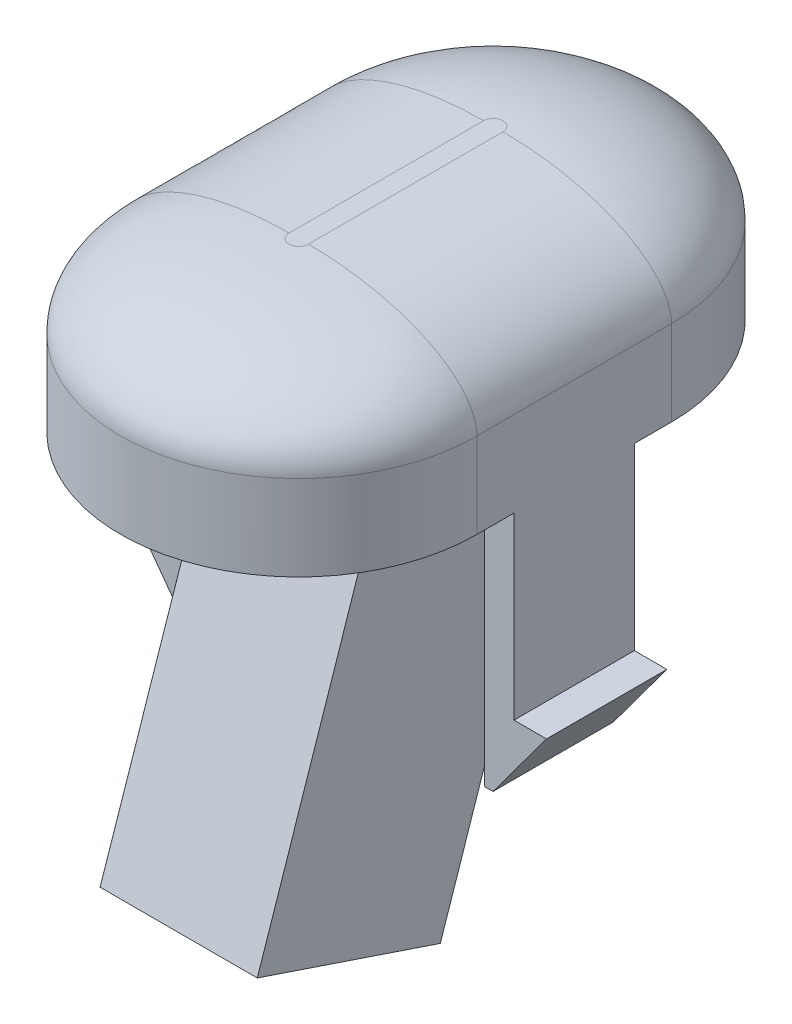
from build123d import *

# Parameters (mm, degrees)
SKETCH1_W           = 14.8
SKETCH1_H           = 8.08
BOSS_EXTRUDE1_DEPTH = 6.94
FILLET1_SIZE        = 7
FILLET1_SIZE_2      = 3.4
SKETCH2_W           = 2.5
SKETCH2_H           = 5
BOSS_EXTRUDE2_DEPTH = 7.45
SKETCH3_W           = 4.44
SKETCH3_H           = 5
BOSS_EXTRUDE3_DEPTH = 3
CUT_EXTRUDE1_REACH  = 26.161
CUT_EXTRUDE2_REACH  = 26.161
CUT_EXTRUDE3_REACH  = 25.756
SKETCH6_W           = 1.27
SKETCH6_H           = 10.45
SKETCH7_W           = 6.5278
SKETCH7_H           = 5
SKETCH7_H_2         = 1.3
BOSS_EXTRUDE4_DEPTH = 2.55634
CUT_EXTRUDE4_REACH  = 24.207
SKETCH9_W           = 6.5278
SKETCH9_H           = 8.018408457
SKETCH9_W_2         = 4.3283
SKETCH9_H_2         = 5.8777
BOSS_EXTRUDE5_DEPTH = 16.3863


with BuildPart() as part:
    # Sketch1 → Boss-Extrude1 (new body)
    with BuildSketch(Plane(origin=(0, 0, 0), x_dir=(1, 0, 0), z_dir=(0, 1, 0))):
        with BuildLine():
            Line((0, -8.08), (14.8, -8.08))
            ThreePointArc((14.8, -8.08), (7.4, -15.48), (0, -8.08))
        make_face()
        with Locations((7.4, -4.04)):
            Rectangle(SKETCH1_W, SKETCH1_H)
        with BuildLine():
            ThreePointArc((0, 0), (7.4, 7.4), (14.8, 0))
            Line((14.8, 0), (0, 0))
        make_face()
    extrude(amount=BOSS_EXTRUDE1_DEPTH)

    # Fillet1
    # an asymmetric fillet: 7, 3.4 mm, written as the material it takes off along each edge
    with BuildSketch(Plane(origin=(7.4, 6.94, 0), x_dir=(-1, 0, 0), z_dir=(0, 0, 1))) as fillet1_piece_1:
        with BuildLine():
            Bezier((7.4 - FILLET1_SIZE, 0), (7.4, 0), (7.4, FILLET1_SIZE_2), weights=[1, 0.707106781, 1])
            Line((7.4, FILLET1_SIZE_2), (7.4, 0))
            Line((7.4, 0), (7.4 - FILLET1_SIZE, 0))
        make_face()
    revolve(axis=Axis((7.4, 6.94, 0), (0, -1, 0)), revolution_arc=180, mode=Mode.SUBTRACT)
    with BuildSketch(Plane(origin=(0, 6.94, 8.08), x_dir=(0, -1, 0), z_dir=(0, 0, -1)), Plane(origin=(14.8, 6.94, 0), x_dir=(0, -1, 0), z_dir=(0, 0, 1))) as fillet1_piece_2:
        with BuildLine():
            Bezier((FILLET1_SIZE_2, 0), (0, 0), (0, -FILLET1_SIZE), weights=[1, 0.707106781, 1])
            Line((0, -FILLET1_SIZE), (0, 0))
            Line((0, 0), (FILLET1_SIZE_2, 0))
        make_face()
    extrude(amount=8.08, mode=Mode.SUBTRACT)
    with BuildSketch(Plane(origin=(7.4, 6.94, 8.08), x_dir=(1, 0, 0), z_dir=(0, 0, -1))) as fillet1_piece_3:
        with BuildLine():
            Bezier((7.4, FILLET1_SIZE_2), (7.4, 0), (7.4 - FILLET1_SIZE, 0), weights=[1, 0.707106781, 1])
            Line((7.4 - FILLET1_SIZE, 0), (7.4, 0))
            Line((7.4, 0), (7.4, FILLET1_SIZE_2))
        make_face()
    revolve(axis=Axis((7.4, 6.94, 8.08), (0, -1, 0)), revolution_arc=180, mode=Mode.SUBTRACT)

    # Sketch2 → Boss-Extrude2 (add)
    with BuildSketch(Plane.XZ):
        with Locations((1.25, 4.04)):
            Rectangle(SKETCH2_W, SKETCH2_H)
        with Locations((13.55, 4.04)):
            Rectangle(SKETCH2_W, SKETCH2_H)
    extrude(amount=BOSS_EXTRUDE2_DEPTH)

    # Sketch3 → Boss-Extrude3 (add)
    with BuildSketch(Plane(origin=(0, -7.45, 0), x_dir=(-1, 0, 0), z_dir=(0, -1, 0))):
        with Locations((-0.28, -4.04)):
            Rectangle(SKETCH3_W, SKETCH3_H)
        with Locations((-14.52, -4.04)):
            Rectangle(SKETCH3_W, SKETCH3_H)
    extrude(amount=BOSS_EXTRUDE3_DEPTH)

    # Sketch4 → Cut-Extrude1 (cut, up to next)
    with BuildSketch(Plane(origin=(0, 0, 1.54), x_dir=(-1, 0, 0), z_dir=(0, 0, -1)), mode=Mode.PRIVATE) as cut_extrude1_sk1:
        Polygon((1.94, -7.45), (-0.28, -10.45), (1.94, -10.45), align=None)
    cut_extrude1_tool1 = extrude(cut_extrude1_sk1.sketch, amount=-CUT_EXTRUDE1_REACH, mode=Mode.PRIVATE) & part.part
    # Sketch4 → Cut-Extrude1 (cut, up to next)
    with BuildSketch(Plane(origin=(0, 0, 1.54), x_dir=(-1, 0, 0), z_dir=(0, 0, -1)), mode=Mode.PRIVATE) as cut_extrude1_sk2:
        Polygon((-16.74, -7.45), (-16.74, -10.45), (-14.52, -10.45), align=None)
    cut_extrude1_tool2 = extrude(cut_extrude1_sk2.sketch, amount=-CUT_EXTRUDE1_REACH, mode=Mode.PRIVATE) & part.part
    add(cut_extrude1_tool1.solids().sort_by_distance((-1.2, -9.45, 1.54))[0], mode=Mode.SUBTRACT)
    add(cut_extrude1_tool2.solids().sort_by_distance((16, -9.45, 1.54))[0], mode=Mode.SUBTRACT)

    # Sketch5 → Cut-Extrude2 (cut, up to next)
    with BuildSketch(Plane(origin=(0, 0, 1.54), x_dir=(-1, 0, 0), z_dir=(0, 0, -1)), mode=Mode.PRIVATE) as cut_extrude2_sk1:
        Polygon((-0.28, -10.45), (-0.87, -10.45), (1.35, -7.45), (1.94, -7.45), align=None)
    cut_extrude2_tool1 = extrude(cut_extrude2_sk1.sketch, amount=-CUT_EXTRUDE2_REACH, mode=Mode.PRIVATE) & part.part
    # Sketch5 → Cut-Extrude2 (cut, up to next)
    with BuildSketch(Plane(origin=(0, 0, 1.54), x_dir=(-1, 0, 0), z_dir=(0, 0, -1)), mode=Mode.PRIVATE) as cut_extrude2_sk2:
        Polygon((-14.52, -10.45), (-13.93, -10.45), (-16.15, -7.45), (-16.74, -7.45), align=None)
    cut_extrude2_tool2 = extrude(cut_extrude2_sk2.sketch, amount=-CUT_EXTRUDE2_REACH, mode=Mode.PRIVATE) & part.part
    add(cut_extrude2_tool1.solids().sort_by_distance((-0.535, -8.95, 1.54))[0], mode=Mode.SUBTRACT)
    add(cut_extrude2_tool2.solids().sort_by_distance((15.335, -8.95, 1.54))[0], mode=Mode.SUBTRACT)

    # Sketch6 → Cut-Extrude3 (cut, up to next)
    with BuildSketch(Plane(origin=(0, 0, 1.54), x_dir=(-1, 0, 0), z_dir=(0, 0, -1)), mode=Mode.PRIVATE) as cut_extrude3_sk1:
        with Locations((-1.865, -5.225)):
            Rectangle(SKETCH6_W, SKETCH6_H)
    cut_extrude3_tool1 = extrude(cut_extrude3_sk1.sketch, amount=-CUT_EXTRUDE3_REACH, mode=Mode.PRIVATE) & part.part
    # Sketch6 → Cut-Extrude3 (cut, up to next)
    with BuildSketch(Plane(origin=(0, 0, 1.54), x_dir=(-1, 0, 0), z_dir=(0, 0, -1)), mode=Mode.PRIVATE) as cut_extrude3_sk2:
        with Locations((-12.935, -5.225)):
            Rectangle(SKETCH6_W, SKETCH6_H)
    cut_extrude3_tool2 = extrude(cut_extrude3_sk2.sketch, amount=-CUT_EXTRUDE3_REACH, mode=Mode.PRIVATE) & part.part
    add(cut_extrude3_tool1.solids().sort_by_distance((1.865, -5.225, 1.54))[0], mode=Mode.SUBTRACT)
    add(cut_extrude3_tool2.solids().sort_by_distance((12.935, -5.225, 1.54))[0], mode=Mode.SUBTRACT)

    # Sketch7 → Boss-Extrude4 (add)
    with BuildSketch(Plane.XZ):
        with Locations((7.3989, 4.04)):
            Rectangle(SKETCH7_W, SKETCH7_H)
        with Locations((7.3989, 0.89)):
            Rectangle(SKETCH7_W, SKETCH7_H_2)
        with Locations((7.3989, 7.19)):
            Rectangle(SKETCH7_W, SKETCH7_H_2)
    extrude(amount=BOSS_EXTRUDE4_DEPTH)

    # Sketch8 → Cut-Extrude4 (cut, up to next)
    with BuildSketch(Plane(origin=(10.6628, 0, 0), x_dir=(0, 0, -1), z_dir=(1, 0, 0)), mode=Mode.PRIVATE) as cut_extrude4_sk1:
        Polygon((-0.24, -2.55634), (-7.84, 0), (-7.84, -2.55634), align=None)
    cut_extrude4_tool1 = extrude(cut_extrude4_sk1.sketch, amount=-CUT_EXTRUDE4_REACH, mode=Mode.PRIVATE) & part.part
    add(cut_extrude4_tool1.solids().sort_by_distance((10.6628, -1.704227, 5.306667))[0], mode=Mode.SUBTRACT)

    # Sketch9 → Boss-Extrude5 (add)
    with BuildSketch(Plane(origin=(0, -2.369037415, 0.796850672), x_dir=(1, 0, 0), z_dir=(0, -0.9478190142131836, 0.31880890247285915))):
        with Locations((7.3989, 3.421696842)):
            Rectangle(SKETCH9_W, SKETCH9_H)
        with Locations((7.3989, 3.421696843)):
            Rectangle(SKETCH9_W_2, SKETCH9_H_2, mode=Mode.SUBTRACT)
    extrude(amount=BOSS_EXTRUDE5_DEPTH)


solid = part.part
